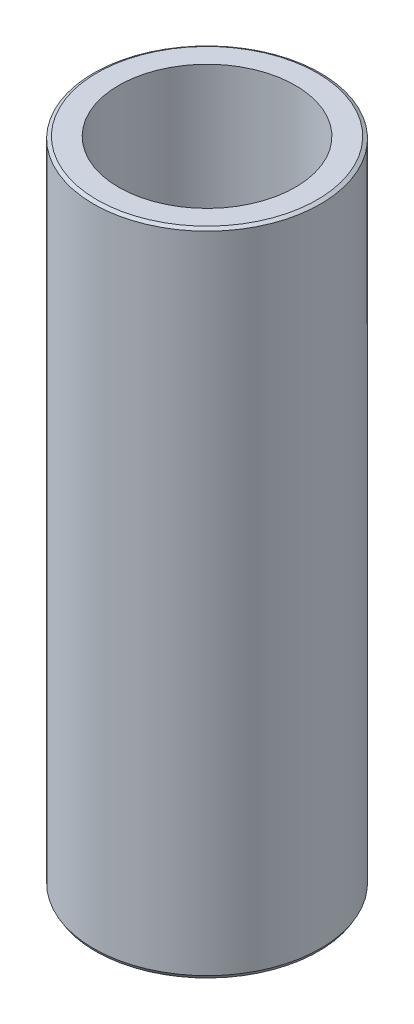
from build123d import *
from OCP.BRepFilletAPI import BRepFilletAPI_MakeChamfer

# Parameters (mm, degrees)
SKETCH1_R           = 17.5
BOSS_EXTRUDE1_DEPTH = 100.267649904
SKETCH2_R           = 13.621903189
CUT_EXTRUDE1_DEPTH  = 104.276820329
CHAMFER1_SIZE       = 0.302713702
CHAMFER1_SIZE2      = 0.524315512


with BuildPart() as part:
    # Sketch1 → Boss-Extrude1 (new body)
    with BuildSketch(Plane(origin=(0, 0, 0), x_dir=(1, 0, 0), z_dir=(0, 1, 0))):
        Circle(SKETCH1_R)
    extrude(amount=BOSS_EXTRUDE1_DEPTH)

    # Sketch2 → Cut-Extrude1 (cut, through all)
    with BuildSketch(Plane(origin=(0, 0, 0), x_dir=(1, 0, 0), z_dir=(0, 1, 0))):
        Circle(SKETCH2_R)
    extrude(amount=CUT_EXTRUDE1_DEPTH, mode=Mode.SUBTRACT)

    # Chamfer1: one chamfer whose edges measure the first distance from different faces: ONE call of the kernel's chamfer builder (chamfer() names one face for all edges)
    chamfer1_edges_1 = [part.edges().sort_by_distance(p)[0] for p in [
        (-17.5, 100.267649904, 0),
    ]]
    chamfer1_side_1 = [part.faces().sort_by_distance(p)[0] for p in [
        (-17.5, 50.133824952, 0),
    ]]
    chamfer1_edges_2 = [part.edges().sort_by_distance(p)[0] for p in [
        (-17.5, 0, 0),
    ]]
    chamfer1_side_2 = [part.faces().sort_by_distance(p)[0] for p in [
        (-17.005025253, 0, 0),
    ]]
    chamfer1 = BRepFilletAPI_MakeChamfer(part.part.solid().wrapped)
    for e in chamfer1_edges_1:
        chamfer1.Add(CHAMFER1_SIZE, CHAMFER1_SIZE2, e.wrapped, chamfer1_side_1[0].wrapped)  # the first distance lies on this face
    for e in chamfer1_edges_2:
        chamfer1.Add(CHAMFER1_SIZE, CHAMFER1_SIZE2, e.wrapped, chamfer1_side_2[0].wrapped)  # the first distance lies on this face
    add(Compound.cast(chamfer1.Shape()), mode=Mode.REPLACE)


solid = part.part
